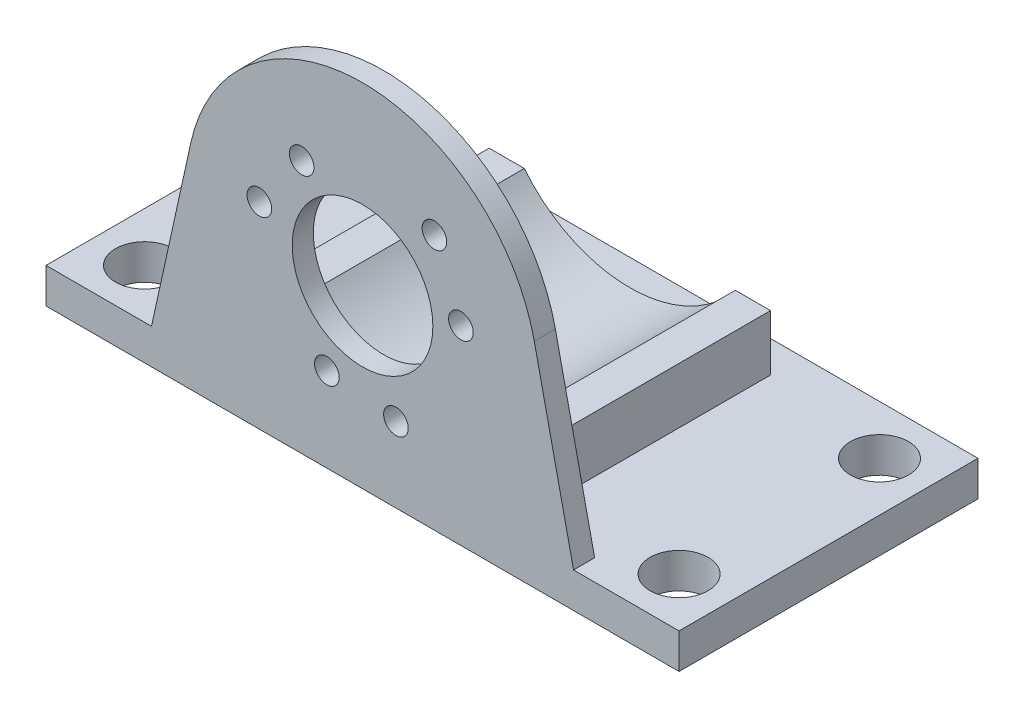
from build123d import *

# Parameters (mm, degrees)
SKETCH3_W           = 90
SKETCH3_H           = 42.5
SKETCH3_R           = 4.125
BOSS_EXTRUDE1_DEPTH = 5
SKETCH4_R           = 1.75
SKETCH4_R_2         = 10
BOSS_EXTRUDE2_DEPTH = 3
BOSS_EXTRUDE3_DEPTH = 35


with BuildPart() as part:
    # Sketch3 → Boss-Extrude1 (new body)
    with BuildSketch(Plane(origin=(0, 0, 0), x_dir=(1, 0, 0), z_dir=(0, 1, 0))):
        Rectangle(SKETCH3_W, SKETCH3_H)
        with Locations((-38, 14.25)):
            Circle(SKETCH3_R, mode=Mode.SUBTRACT)
        with Locations((38, 14.25)):
            Circle(SKETCH3_R, mode=Mode.SUBTRACT)
        with Locations((38, -14.25)):
            Circle(SKETCH3_R, mode=Mode.SUBTRACT)
        with Locations((-38, -14.25)):
            Circle(SKETCH3_R, mode=Mode.SUBTRACT)
    extrude(amount=BOSS_EXTRUDE1_DEPTH)

    # Sketch4 → Boss-Extrude2 (add)
    with BuildSketch(Plane.XY.offset(21.25)):
        with BuildLine():
            Line((-30, 5), (30, 5))
            Line((30, 5), (24.415677736, 30.373516604))
            ThreePointArc((24.415677736, 30.373516604), (0, 50), (-24.415677736, 30.373516604))
            Line((-24.415677736, 30.373516604), (-30, 5))
        make_face()
        with Locations((10.21923709, 36.347341968)):
            Circle(SKETCH4_R, mode=Mode.SUBTRACT)
        with Locations((-5.067303705, 12.010919994)):
            Circle(SKETCH4_R, mode=Mode.SUBTRACT)
        with Locations((4.749376983, 10.674714152)):
            Circle(SKETCH4_R, mode=Mode.SUBTRACT)
        with Locations((0, 25)):
            Circle(SKETCH4_R_2, mode=Mode.SUBTRACT)
        with Locations((13.990382911, 27.080076467)):
            Circle(SKETCH4_R, mode=Mode.SUBTRACT)
        with Locations((-14.667309102, 27.992284383)):
            Circle(SKETCH4_R, mode=Mode.SUBTRACT)
        with Locations((-8.654917128, 36.087456884)):
            Circle(SKETCH4_R, mode=Mode.SUBTRACT)
    extrude(amount=-BOSS_EXTRUDE2_DEPTH)

    # Sketch5 → Boss-Extrude3 (add)
    with BuildSketch(Plane(origin=(0, 0, 18.25), x_dir=(-1, 0, 0), z_dir=(0, 0, -1))):
        with BuildLine():
            ThreePointArc((15, 12.935071488), (0, 5.75), (-15, 12.935071488))
            Line((-15, 12.935071488), (-20, 12.935071488))
            Line((-20, 12.935071488), (-20, 5))
            Line((-20, 5), (20, 5))
            Line((20, 5), (20, 12.935071488))
            Line((20, 12.935071488), (15, 12.935071488))
        make_face()
    extrude(amount=BOSS_EXTRUDE3_DEPTH)


solid = part.part
